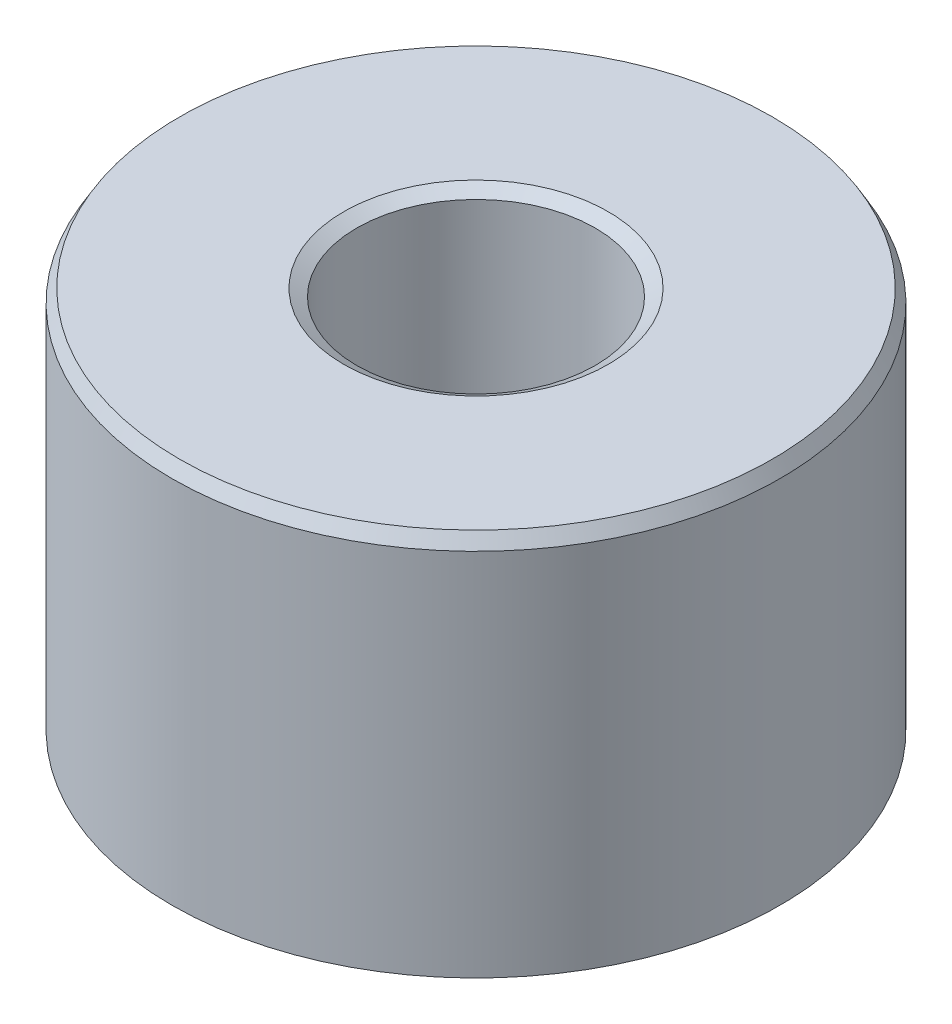
from build123d import *
from OCP.BRepFilletAPI import BRepFilletAPI_MakeChamfer

# Parameters (mm, degrees)
SKETCH1_R           = 60
BOSS_EXTRUDE1_DEPTH = 76.996689486
SKETCH2_R           = 23.525631422
CUT_EXTRUDE1_DEPTH  = 115.579623807
CHAMFER1_SIZE       = 2.583750559
CHAMFER1_SIZE2      = 1.491729081


with BuildPart() as part:
    # Sketch1 → Boss-Extrude1 (new body)
    with BuildSketch(Plane(origin=(0, 0, 0), x_dir=(1, 0, 0), z_dir=(0, 1, 0))):
        Circle(SKETCH1_R)
    extrude(amount=BOSS_EXTRUDE1_DEPTH)

    # Sketch2 → Cut-Extrude1 (cut, through all)
    with BuildSketch(Plane(origin=(0, 0, 0), x_dir=(1, 0, 0), z_dir=(0, 1, 0))):
        Circle(SKETCH2_R)
    extrude(amount=CUT_EXTRUDE1_DEPTH, mode=Mode.SUBTRACT)

    # Chamfer1: one chamfer whose edges measure the first distance from different faces: ONE call of the kernel's chamfer builder (chamfer() names one face for all edges)
    chamfer1_edges_1 = [part.edges().sort_by_distance(p)[0] for p in [
        (-23.525631422, 76.996689486, 0),
    ]]
    chamfer1_side_1 = [part.faces().sort_by_distance(p)[0] for p in [
        (-58.302943725, 76.996689486, 0),
    ]]
    chamfer1_edges_2 = [part.edges().sort_by_distance(p)[0] for p in [
        (-23.525631422, 0, 0),
    ]]
    chamfer1_side_2 = [part.faces().sort_by_distance(p)[0] for p in [
        (-23.525631422, 38.498344743, 0),
    ]]
    chamfer1_edges_3 = [part.edges().sort_by_distance(p)[0] for p in [
        (-60, 0, 0),
    ]]
    chamfer1_side_3 = [part.faces().sort_by_distance(p)[0] for p in [
        (-58.302943725, 0, 0),
    ]]
    chamfer1_edges_4 = [part.edges().sort_by_distance(p)[0] for p in [
        (-60, 76.996689486, 0),
    ]]
    chamfer1_side_4 = [part.faces().sort_by_distance(p)[0] for p in [
        (-60, 38.498344743, 0),
    ]]
    chamfer1 = BRepFilletAPI_MakeChamfer(part.part.solid().wrapped)
    for e in chamfer1_edges_1:
        chamfer1.Add(CHAMFER1_SIZE, CHAMFER1_SIZE2, e.wrapped, chamfer1_side_1[0].wrapped)  # the first distance lies on this face
    for e in chamfer1_edges_2:
        chamfer1.Add(CHAMFER1_SIZE, CHAMFER1_SIZE2, e.wrapped, chamfer1_side_2[0].wrapped)  # the first distance lies on this face
    for e in chamfer1_edges_3:
        chamfer1.Add(CHAMFER1_SIZE, CHAMFER1_SIZE2, e.wrapped, chamfer1_side_3[0].wrapped)  # the first distance lies on this face
    for e in chamfer1_edges_4:
        chamfer1.Add(CHAMFER1_SIZE, CHAMFER1_SIZE2, e.wrapped, chamfer1_side_4[0].wrapped)  # the first distance lies on this face
    add(Compound.cast(chamfer1.Shape()), mode=Mode.REPLACE)


solid = part.part
